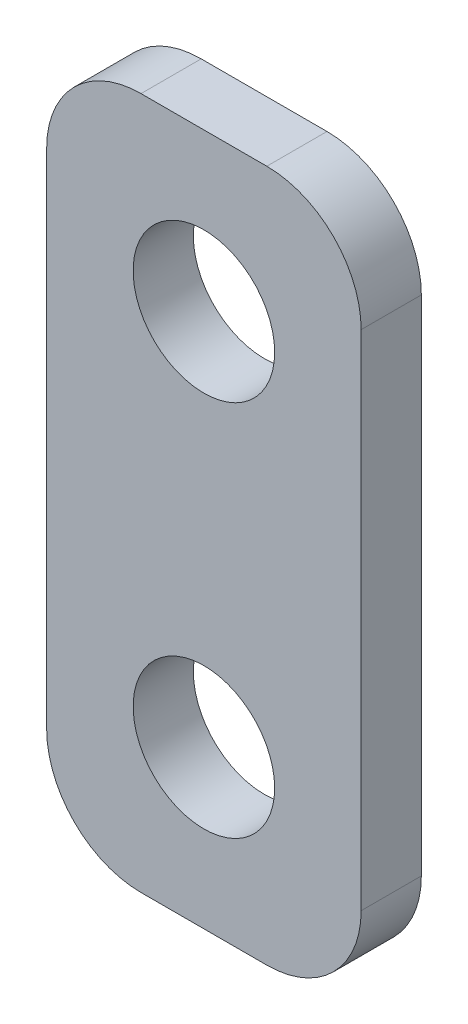
from build123d import *

# Parameters (mm, degrees)
SKETCH1_W                       = 15.875
SKETCH1_H                       = 34.925
BASE_FLANGE1_DEPTH              = 3.03784
F_9_32_0_28125_DIAMETER_HOLE1_D = 7.14375
BREAK_CORNER1_DEPTH             = 3.03784


# Read off the part's stored shape, not the designer's step: Break-Corner1
# Sheet-metal steps are written as plain solids
with BuildPart() as part:
    # Sketch1 → Base-Flange1 (new body)
    with BuildSketch(Plane.XY):
        Rectangle(SKETCH1_W, SKETCH1_H)
    extrude(amount=BASE_FLANGE1_DEPTH)

    # 9/32 (0.28125) Diameter Hole1 (through all)
    with Locations(Plane.XY.offset(3.03784)):
        with Locations((0, 9.525), (0, -9.525)):
            Hole(F_9_32_0_28125_DIAMETER_HOLE1_D / 2)

    # Break-Corner1 outline → Break-Corner1 (cut)
    with BuildSketch(Plane.XY):
        with BuildLine():
            Line((-7.9375, -17.4625), (-3.175, -17.4625))
            ThreePointArc((-3.175, -17.4625), (-6.542596045, -16.067596045), (-7.9375, -12.7))
            Line((-7.9375, -12.7), (-7.9375, -17.4625))
        make_face()
        with BuildLine():
            ThreePointArc((7.9375, -12.7), (6.542596045, -16.067596045), (3.175, -17.4625))
            Line((3.175, -17.4625), (7.9375, -17.4625))
            Line((7.9375, -17.4625), (7.9375, -12.7))
        make_face()
        with BuildLine():
            Line((-7.9375, 17.4625), (-7.9375, 12.7))
            ThreePointArc((-7.9375, 12.7), (-6.542596045, 16.067596045), (-3.175, 17.4625))
            Line((-3.175, 17.4625), (-7.9375, 17.4625))
        make_face()
        with BuildLine():
            ThreePointArc((3.175, 17.4625), (6.542596045, 16.067596045), (7.9375, 12.7))
            Line((7.9375, 12.7), (7.9375, 17.4625))
            Line((7.9375, 17.4625), (3.175, 17.4625))
        make_face()
    extrude(amount=BREAK_CORNER1_DEPTH, mode=Mode.SUBTRACT)


solid = part.part
